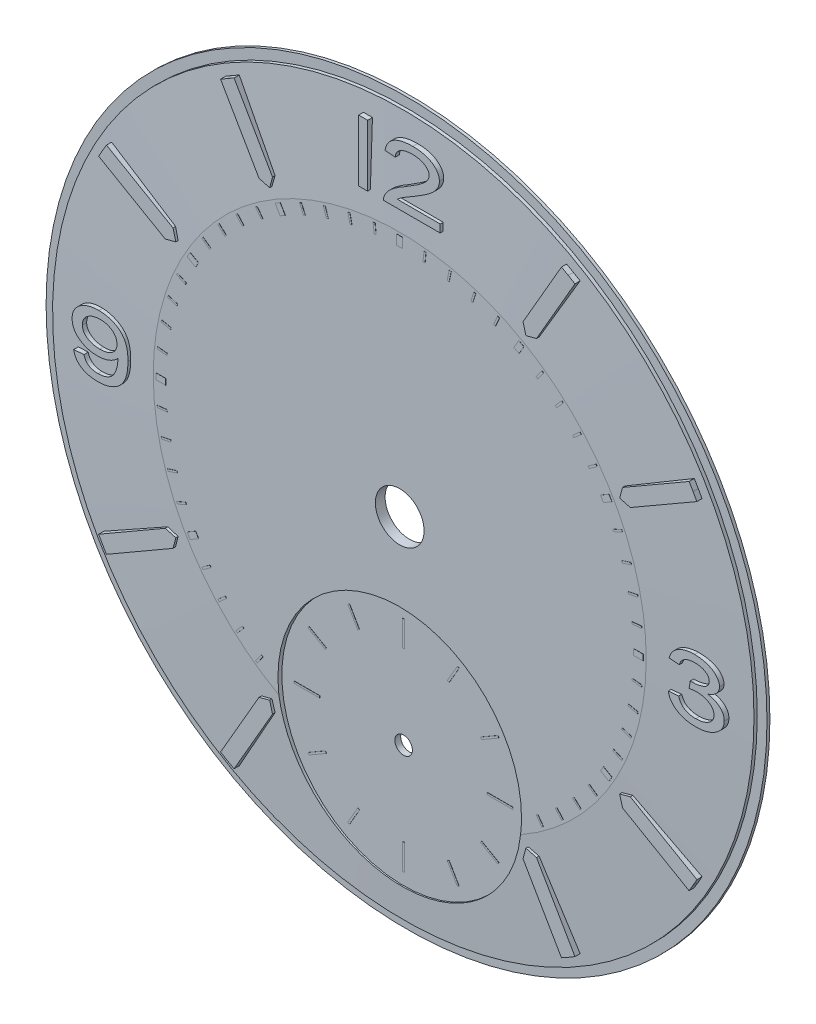
from build123d import *

# Parameters (mm, degrees)
SKETCH1_R           = 18.5
BOSS_EXTRUDE1_DEPTH = 0.5
CUT_EXTRUDE1_REACH  = 28.168
SKETCH2_R           = 1.25
SKETCH2_R_2         = 0.45
SKETCH11_R          = 1.25
BOSS_EXTRUDE7_DEPTH = 0.7
SKETCH12_R          = 0.55
BOSS_EXTRUDE8_DEPTH = 1.5
CHAMFER1_SIZE       = 0.7
CUT_EXTRUDE2_START  = 0.5
SKETCH4_R           = 6.25
CUT_EXTRUDE2_DEPTH  = 0.2
BOSS_EXTRUDE2_REACH = 28.855
BOSS_EXTRUDE2_START = 0.6
BOSS_EXTRUDE3_REACH = 28.855
BOSS_EXTRUDE3_START = 0.6
SKETCH6_W           = 0.46
SKETCH6_H           = 3.15
BOSS_EXTRUDE4_DEPTH = 0.01
SKETCH9_W           = 0.3
SKETCH9_H           = 0.500037505
SKETCH9_W_2         = 0.500037505
SKETCH9_H_2         = 0.3
BOSS_EXTRUDE5_DEPTH = 0.01
BOSS_EXTRUDE6_DEPTH = 0.01


with BuildPart() as part:
    # Sketch1 → Boss-Extrude1 (new body)
    with BuildSketch(Plane.XY):
        Circle(SKETCH1_R)
    extrude(amount=BOSS_EXTRUDE1_DEPTH)

    # Sketch2 → Cut-Extrude1 (cut, up to next)
    with BuildSketch(Plane.XY, mode=Mode.PRIVATE) as cut_extrude1_sk1:
        Circle(SKETCH2_R)
    cut_extrude1_tool1 = extrude(cut_extrude1_sk1.sketch, amount=CUT_EXTRUDE1_REACH, mode=Mode.PRIVATE) & part.part
    # Sketch2 → Cut-Extrude1 (cut, up to next)
    with BuildSketch(Plane.XY, mode=Mode.PRIVATE) as cut_extrude1_sk2:
        with Locations((0, -10.25)):
            Circle(SKETCH2_R_2)
    cut_extrude1_tool2 = extrude(cut_extrude1_sk2.sketch, amount=CUT_EXTRUDE1_REACH, mode=Mode.PRIVATE) & part.part
    add(cut_extrude1_tool1.solids().sort_by_distance((0, 0, 0))[0], mode=Mode.SUBTRACT)
    add(cut_extrude1_tool2.solids().sort_by_distance((0, -10.25, 0))[0], mode=Mode.SUBTRACT)

    # Sketch11 → Boss-Extrude7 (add)
    with BuildSketch(Plane(origin=(0, 0, 0), x_dir=(-1, 0, 0), z_dir=(0, 0, -1))):
        with Locations(Location((12.281, 9.674, 0), (0, 0, 180))):
            Circle(SKETCH11_R)
        with Locations(Location((-10.269, -11.676, 0), (0, 0, 180))):
            Circle(SKETCH11_R)
    extrude(amount=BOSS_EXTRUDE7_DEPTH)

    # Sketch12 → Boss-Extrude8 (add)
    with BuildSketch(Plane(origin=(0, 0, -0.7), x_dir=(-1, 0, 0), z_dir=(0, 0, -1))):
        with Locations((12.281, 9.674)):
            Circle(SKETCH12_R)
        with Locations((-10.269, -11.676)):
            Circle(SKETCH12_R)
    extrude(amount=BOSS_EXTRUDE8_DEPTH)

    # Chamfer1
    chamfer1_edges = [part.edges().sort_by_distance(p)[0] for p in [
        (-13.531, 9.674, -0.7),
        (9.019, -11.676, -0.7),
    ]]
    chamfer(chamfer1_edges, length=CHAMFER1_SIZE - 0.0001)  # a hair under: the kernel refuses the full size

    # Sketch3 → Cut-Revolve1 (revolve, cut)
    with BuildSketch(Plane(origin=(0, 0, 0), x_dir=(1, 0, 0), z_dir=(0, 1, 0))):
        Polygon((12.65, -0.5), (18, -0.317094017), (18, -0.15), (18.92774664, -0.15), (18.92659694, -0.3), (18.92659694, -0.873301672), (12.65, -0.873301672), align=None)
    revolve(axis=Axis((0, 0, 1000), (0, 0, -1)), mode=Mode.SUBTRACT)

    # Sketch4 → Cut-Extrude2 (cut)
    with BuildSketch(Plane.XY.offset(CUT_EXTRUDE2_START)):
        with Locations((0, -10.25)):
            Circle(SKETCH4_R)
    extrude(amount=-CUT_EXTRUDE2_DEPTH, mode=Mode.SUBTRACT)

    # Boss-Extrude2: up to this cone (the profile starts outside it)
    boss_extrude2_end = Plane(origin=(0, 0, 0.6), z_dir=(0, 0, -1)).offset(-0.332477632) * Cone(2.925e-05, 1152.815000001, 39.412477632, align=(Align.CENTER, Align.CENTER, Align.MIN), mode=Mode.PRIVATE)
    # Sketch5 → Boss-Extrude2 (add, up to the surface)
    with BuildSketch(Plane.XY.offset(BOSS_EXTRUDE2_START), mode=Mode.PRIVATE) as boss_extrude2_sk1:
        Polygon((6.575, 11.38823406), (7.121410162, 11.534644221), (9.094124149, 14.951485076), (8.75, 15.155444566), (8.401303826, 15.351485076), (6.428589838, 11.934644221), align=None)
    boss_extrude2_tool1 = extrude(boss_extrude2_sk1.sketch, amount=-BOSS_EXTRUDE2_REACH, mode=Mode.PRIVATE) - boss_extrude2_end
    add(boss_extrude2_tool1.solids().sort_by_distance((7.711125, 13.35606, 0.6))[0])
    # Sketch5 → Boss-Extrude2 (add, up to the surface)
    with BuildSketch(Plane.XY.offset(BOSS_EXTRUDE2_START), mode=Mode.PRIVATE) as boss_extrude2_sk2:
        Polygon((15.351485076, 8.401303826), (15.155444566, 8.75), (14.951485076, 9.094124149), (11.534644221, 7.121410162), (11.38823406, 6.575), (11.934644221, 6.428589838), align=None)
    boss_extrude2_tool2 = extrude(boss_extrude2_sk2.sketch, amount=-BOSS_EXTRUDE2_REACH, mode=Mode.PRIVATE) - boss_extrude2_end
    add(boss_extrude2_tool2.solids().sort_by_distance((13.35606, 7.711125, 0.6))[0])
    # Sketch5 → Boss-Extrude2 (add, up to the surface)
    with BuildSketch(Plane.XY.offset(BOSS_EXTRUDE2_START), mode=Mode.PRIVATE) as boss_extrude2_sk3:
        Polygon((14.951485076, -9.094124149), (15.155444566, -8.75), (15.351485076, -8.401303826), (11.934644221, -6.428589838), (11.38823406, -6.575), (11.534644221, -7.121410162), align=None)
    boss_extrude2_tool3 = extrude(boss_extrude2_sk3.sketch, amount=-BOSS_EXTRUDE2_REACH, mode=Mode.PRIVATE) - boss_extrude2_end
    add(boss_extrude2_tool3.solids().sort_by_distance((13.35606, -7.711125, 0.6))[0])
    # Sketch5 → Boss-Extrude2 (add, up to the surface)
    with BuildSketch(Plane.XY.offset(BOSS_EXTRUDE2_START), mode=Mode.PRIVATE) as boss_extrude2_sk4:
        Polygon((8.401303826, -15.351485076), (8.75, -15.155444566), (9.094124149, -14.951485076), (7.121410162, -11.534644221), (6.575, -11.38823406), (6.428589838, -11.934644221), align=None)
    boss_extrude2_tool4 = extrude(boss_extrude2_sk4.sketch, amount=-BOSS_EXTRUDE2_REACH, mode=Mode.PRIVATE) - boss_extrude2_end
    add(boss_extrude2_tool4.solids().sort_by_distance((7.711125, -13.35606, 0.6))[0])
    # Sketch5 → Boss-Extrude2 (add, up to the surface)
    with BuildSketch(Plane.XY.offset(BOSS_EXTRUDE2_START), mode=Mode.PRIVATE) as boss_extrude2_sk5:
        Polygon((-9.094124149, -14.951485076), (-8.75, -15.155444566), (-8.401303826, -15.351485076), (-6.428589838, -11.934644221), (-6.575, -11.38823406), (-7.121410162, -11.534644221), align=None)
    boss_extrude2_tool5 = extrude(boss_extrude2_sk5.sketch, amount=-BOSS_EXTRUDE2_REACH, mode=Mode.PRIVATE) - boss_extrude2_end
    add(boss_extrude2_tool5.solids().sort_by_distance((-7.711125, -13.35606, 0.6))[0])
    # Sketch5 → Boss-Extrude2 (add, up to the surface)
    with BuildSketch(Plane.XY.offset(BOSS_EXTRUDE2_START), mode=Mode.PRIVATE) as boss_extrude2_sk6:
        Polygon((-15.351485076, -8.401303826), (-15.155444566, -8.75), (-14.951485076, -9.094124149), (-11.534644221, -7.121410162), (-11.38823406, -6.575), (-11.934644221, -6.428589838), align=None)
    boss_extrude2_tool6 = extrude(boss_extrude2_sk6.sketch, amount=-BOSS_EXTRUDE2_REACH, mode=Mode.PRIVATE) - boss_extrude2_end
    add(boss_extrude2_tool6.solids().sort_by_distance((-13.35606, -7.711125, 0.6))[0])
    # Sketch5 → Boss-Extrude2 (add, up to the surface)
    with BuildSketch(Plane.XY.offset(BOSS_EXTRUDE2_START), mode=Mode.PRIVATE) as boss_extrude2_sk7:
        Polygon((-14.951485076, 9.094124149), (-15.155444566, 8.75), (-15.351485076, 8.401303826), (-11.934644221, 6.428589838), (-11.38823406, 6.575), (-11.534644221, 7.121410162), align=None)
    boss_extrude2_tool7 = extrude(boss_extrude2_sk7.sketch, amount=-BOSS_EXTRUDE2_REACH, mode=Mode.PRIVATE) - boss_extrude2_end
    add(boss_extrude2_tool7.solids().sort_by_distance((-13.35606, 7.711125, 0.6))[0])
    # Sketch5 → Boss-Extrude2 (add, up to the surface)
    with BuildSketch(Plane.XY.offset(BOSS_EXTRUDE2_START), mode=Mode.PRIVATE) as boss_extrude2_sk8:
        Polygon((-8.401303826, 15.351485076), (-8.75, 15.155444566), (-9.094124149, 14.951485076), (-7.121410162, 11.534644221), (-6.575, 11.38823406), (-6.428589838, 11.934644221), align=None)
    boss_extrude2_tool8 = extrude(boss_extrude2_sk8.sketch, amount=-BOSS_EXTRUDE2_REACH, mode=Mode.PRIVATE) - boss_extrude2_end
    add(boss_extrude2_tool8.solids().sort_by_distance((-7.711125, 13.35606, 0.6))[0])

    # Boss-Extrude3: up to this cone (the profile starts outside it)
    boss_extrude3_end = Plane(origin=(0, 0, 0.6), z_dir=(0, 0, -1)).offset(-0.332477632) * Cone(2.925e-05, 1152.815000001, 39.412477632, align=(Align.CENTER, Align.CENTER, Align.MIN), mode=Mode.PRIVATE)
    # Sketch6 → Boss-Extrude3 (add, up to the surface)
    with BuildSketch(Plane.XY.offset(BOSS_EXTRUDE3_START), mode=Mode.PRIVATE) as boss_extrude3_sk1:
        with Locations((-1.776843897, 15.325)):
            Rectangle(SKETCH6_W, SKETCH6_H)
    boss_extrude3_tool1 = extrude(boss_extrude3_sk1.sketch, amount=-BOSS_EXTRUDE3_REACH, mode=Mode.PRIVATE) - boss_extrude3_end
    add(boss_extrude3_tool1.solids().sort_by_distance((-1.776844, 15.325, 0.6))[0])
    # Sketch6 → Boss-Extrude3 (add, up to the surface)
    with BuildSketch(Plane.XY.offset(BOSS_EXTRUDE3_START), mode=Mode.PRIVATE) as boss_extrude3_sk2:
        with BuildLine():
            Line((2.176923077, 14.153846154), (2.176923077, 13.75))
            Line((2.176923077, 13.75), (-0.730769231, 13.75))
            add(Edge.make_bspline(
                [(-0.730769231, 13.75), (-0.730734683, 13.773801761), (-0.730665513, 13.821456454), (-0.719779166, 13.892481272), (-0.698725172, 13.962001872), (-0.678109362, 14.005994642), (-0.667668269, 14.02827524)],
                knots=[0, 0, 0, 0, 0.989243062, 1.980612825, 2.977260274, 4, 4, 4, 4], degree=3))
            add(Edge.make_bspline(
                [(-0.667668269, 14.02827524), (-0.647284543, 14.065209714), (-0.605166279, 14.141526279), (-0.522772684, 14.249013191), (-0.424981238, 14.355602486), (-0.330460341, 14.441240537), (-0.24617537, 14.510878124), (-0.174790035, 14.564857758), (-0.096887456, 14.620542359), (-0.012584844, 14.677547534), (0.077965903, 14.736772872), (0.175675543, 14.79625478), (0.279915656, 14.85748709), (0.35178063, 14.898317805), (0.388641827, 14.919260817)],
                knots=[0, 0, 0, 0, 1.082780595, 2.23731618, 3.469163426, 4.796636591, 5.510850007, 6.278397041, 7.095858807, 7.971372559, 8.893386428, 9.876020042, 10.91056187, 12, 12, 12, 12], degree=3))
            add(Edge.make_bspline(
                [(0.388641827, 14.919260817), (0.445292328, 14.953431166), (0.554273617, 15.019166308), (0.710001949, 15.115602301), (0.852062308, 15.205848747), (0.979384685, 15.290962136), (1.093809159, 15.368703826), (1.192716293, 15.442368609), (1.278642324, 15.508653387), (1.351686129, 15.570136196), (1.413201925, 15.628957661), (1.465967037, 15.686317715), (1.51027665, 15.743433172), (1.547691208, 15.799414011), (1.575477347, 15.856078609), (1.595823996, 15.911873622), (1.609576145, 15.967125098), (1.610892005, 16.00410039), (1.611538462, 16.022265625)],
                knots=[0, 0, 0, 0, 1.868118289, 3.593788876, 5.172198056, 6.620162334, 7.918373262, 9.077768068, 10.101891799, 10.982542333, 11.772277537, 12.50380925, 13.1810016, 13.811946086, 14.401621127, 14.957769458, 15.487972581, 16, 16, 16, 16], degree=3))
            add(Edge.make_bspline(
                [(1.611538462, 16.022265625), (1.610745361, 16.039975811), (1.609172808, 16.075091397), (1.598554309, 16.12684664), (1.578759707, 16.175625374), (1.553624366, 16.223263528), (1.519659301, 16.267829013), (1.478772576, 16.310536787), (1.430359275, 16.35088742), (1.375312931, 16.389009764), (1.314210633, 16.423503409), (1.248324575, 16.453756531), (1.177987432, 16.479941252), (1.102887351, 16.500221592), (1.023530127, 16.517038386), (0.939750252, 16.527858491), (0.85150834, 16.535082743), (0.79124142, 16.536044694), (0.76030649, 16.536538462)],
                knots=[0, 0, 0, 0, 0.775419244, 1.537493863, 2.298399441, 3.072943494, 3.888749766, 4.741893806, 5.656754112, 6.642668583, 7.669401872, 8.724078032, 9.81362824, 10.950698062, 12.126297407, 13.362088999, 14.645963818, 16, 16, 16, 16], degree=3))
            add(Edge.make_bspline(
                [(0.76030649, 16.536538462), (0.727690907, 16.536036152), (0.664066967, 16.535056286), (0.571184002, 16.527958378), (0.483252531, 16.5169206), (0.400338045, 16.500629217), (0.322417377, 16.478962758), (0.249307164, 16.453401791), (0.181173505, 16.423080002), (0.118955962, 16.387831289), (0.062513177, 16.34883766), (0.012862769, 16.305957733), (-0.029000272, 16.258995672), (-0.063729246, 16.208701882), (-0.090314401, 16.15436298), (-0.11005695, 16.096548737), (-0.12228759, 16.034968357), (-0.124085739, 15.992663547), (-0.125, 15.971153846)],
                knots=[0, 0, 0, 0, 1.336175627, 2.606507352, 3.81435817, 4.965286254, 6.065003821, 7.125251149, 8.13586676, 9.116042774, 10.050766458, 10.942513058, 11.797005481, 12.621644516, 13.438683862, 14.267141418, 15.118935392, 16, 16, 16, 16], degree=3))
            Line((-0.125, 15.971153846), (-0.65, 16.011538462))
            add(Edge.make_bspline(
                [(-0.65, 16.011538462), (-0.644513326, 16.046840535), (-0.633767387, 16.115981504), (-0.60391714, 16.215056292), (-0.565588693, 16.30799834), (-0.516614644, 16.394465543), (-0.457444952, 16.474292551), (-0.389004304, 16.547895433), (-0.31055033, 16.614635221), (-0.22243017, 16.674271965), (-0.125890198, 16.728090207), (-0.020638293, 16.773824815), (0.092211307, 16.813037774), (0.212837854, 16.845147187), (0.341525504, 16.869511867), (0.477860044, 16.886919107), (0.62214857, 16.897841735), (0.720953571, 16.899267985), (0.771664663, 16.9)],
                knots=[0, 0, 0, 0, 0.926926747, 1.815434827, 2.679851767, 3.533638517, 4.389171254, 5.25501982, 6.138508896, 7.058276303, 8.014443804, 9.005118448, 10.034834552, 11.114826492, 12.244098521, 13.433982082, 14.683006236, 16, 16, 16, 16], degree=3))
            add(Edge.make_bspline(
                [(0.771664663, 16.9), (0.822802795, 16.899374971), (0.922493349, 16.898156515), (1.068068255, 16.885734958), (1.205509175, 16.866558139), (1.334905221, 16.839679085), (1.455759783, 16.804286174), (1.568525472, 16.761420534), (1.673339713, 16.711023555), (1.768850623, 16.652517272), (1.854529354, 16.588162053), (1.930292214, 16.520381095), (1.99367253, 16.447891852), (2.046635412, 16.372426178), (2.08633817, 16.291955115), (2.115813339, 16.208403355), (2.133399049, 16.120593018), (2.135480637, 16.060836108), (2.136538462, 16.03046875)],
                knots=[0, 0, 0, 0, 1.366966317, 2.664814376, 3.903105881, 5.075541585, 6.194876334, 7.266445866, 8.297663522, 9.299764706, 10.255787209, 11.159518581, 12.012314952, 12.825026505, 13.617244577, 14.403351232, 15.18861259, 16, 16, 16, 16], degree=3))
            add(Edge.make_bspline(
                [(2.136538462, 16.03046875), (2.135367745, 15.999235514), (2.13301135, 15.936369891), (2.112227791, 15.842849812), (2.079735013, 15.750148333), (2.034484867, 15.657339251), (1.972760507, 15.564664209), (1.895408917, 15.470230503), (1.800832437, 15.373454859), (1.709780637, 15.291581318), (1.62474685, 15.223436745), (1.549692108, 15.166443356), (1.463377826, 15.106393105), (1.367805686, 15.04034697), (1.260604143, 14.971329748), (1.143736536, 14.89681964), (1.016028937, 14.818731488), (0.927357759, 14.76564128), (0.881460337, 14.738161058)],
                knots=[0, 0, 0, 0, 0.797472085, 1.605135574, 2.436550896, 3.304515204, 4.236452966, 5.275912425, 6.420307762, 7.691835688, 8.402981861, 9.205097542, 10.1000472, 11.090178053, 12.174238999, 13.358439029, 14.63269166, 16, 16, 16, 16], degree=3))
            add(Edge.make_bspline(
                [(0.881460337, 14.738161058), (0.842760848, 14.715651026), (0.768699194, 14.672572159), (0.662482019, 14.610875296), (0.567002026, 14.55412499), (0.481455859, 14.503331852), (0.406034433, 14.459085302), (0.341130878, 14.419590097), (0.286800924, 14.385701232), (0.228220219, 14.349387049), (0.165982033, 14.306575278), (0.09709343, 14.257221997), (0.036137644, 14.206160463), (-0.001067873, 14.170853905), (-0.018990385, 14.153846154)],
                knots=[0, 0, 0, 0, 1.498073862, 2.866958499, 4.11022804, 5.214683684, 6.196023589, 7.036135443, 7.756818607, 8.338735797, 9.342114208, 10.283889564, 11.173321292, 12, 12, 12, 12], degree=3))
            Line((-0.018990385, 14.153846154), (2.176923077, 14.153846154))
        make_face()
    boss_extrude3_tool2 = extrude(boss_extrude3_sk2.sketch, amount=-BOSS_EXTRUDE3_REACH, mode=Mode.PRIVATE) - boss_extrude3_end
    add(boss_extrude3_tool2.solids().sort_by_distance((2.134054, 13.951923, 0.6))[0])
    # Sketch6 → Boss-Extrude3 (add, up to the surface)
    with BuildSketch(Plane.XY.offset(BOSS_EXTRUDE3_START), mode=Mode.PRIVATE) as boss_extrude3_sk3:
        with BuildLine():
            Line((13.886538462, -0.751923077), (14.411538462, -0.711538462))
            add(Edge.make_bspline(
                [(14.411538462, -0.711538462), (14.419782578, -0.735870822), (14.435856374, -0.783312339), (14.465926226, -0.850814196), (14.499639345, -0.91288714), (14.537328528, -0.969988996), (14.57880749, -1.021464193), (14.623962575, -1.068258628), (14.673431727, -1.109245838), (14.726636748, -1.145475248), (14.78416013, -1.176413729), (14.845283973, -1.203559922), (14.910695185, -1.226393443), (14.980216427, -1.244383709), (15.053545551, -1.258869341), (15.13083423, -1.269665404), (15.212391232, -1.276032449), (15.268227668, -1.276621286), (15.296844952, -1.276923077)],
                knots=[0, 0, 0, 0, 1.081617508, 2.108861367, 3.107907368, 4.053891101, 4.98642157, 5.888579411, 6.788079934, 7.687405932, 8.595244187, 9.535235353, 10.501859968, 11.509666268, 12.557335972, 13.648597587, 14.794859463, 16, 16, 16, 16], degree=3))
            add(Edge.make_bspline(
                [(15.296844952, -1.276923077), (15.330314071, -1.276588049), (15.395904092, -1.275931489), (15.491921925, -1.266387647), (15.583604064, -1.253280267), (15.670137422, -1.232685385), (15.752102824, -1.207608318), (15.829242745, -1.176762838), (15.9016319, -1.139932069), (15.9687876, -1.097919469), (16.029636814, -1.051879059), (16.082474817, -1.002155265), (16.127722043, -0.950430747), (16.16488246, -0.895682633), (16.19353825, -0.837909322), (16.213579665, -0.777338684), (16.22713136, -0.714241049), (16.228268693, -0.671015512), (16.228846154, -0.64906851)],
                knots=[0, 0, 0, 0, 1.28866494, 2.525419338, 3.713690651, 4.853576377, 5.94785981, 7.013081976, 8.049409785, 9.072284432, 10.060791826, 10.983630342, 11.862453451, 12.702902981, 13.525430756, 14.337638125, 15.155965118, 16, 16, 16, 16], degree=3))
            add(Edge.make_bspline(
                [(16.228846154, -0.64906851), (16.22821178, -0.628180198), (16.226964017, -0.587094504), (16.214268224, -0.527083741), (16.194805769, -0.469949053), (16.167269267, -0.415520292), (16.131421771, -0.364297328), (16.088333361, -0.315504111), (16.037159119, -0.2697711), (15.978759981, -0.227552798), (15.914882008, -0.188378866), (15.845599575, -0.155045271), (15.772169695, -0.126578087), (15.694482639, -0.103376379), (15.612673798, -0.085064727), (15.526689724, -0.071772415), (15.436223215, -0.064274341), (15.374472828, -0.06333879), (15.342908654, -0.062860577)],
                knots=[0, 0, 0, 0, 0.850254533, 1.672384945, 2.488414119, 3.30502847, 4.149210918, 5.029865481, 5.952536532, 6.940184485, 7.963464691, 9.002495723, 10.069133905, 11.170250404, 12.303728621, 13.48343305, 14.713637887, 16, 16, 16, 16], degree=3))
            add(Edge.make_bspline(
                [(15.342908654, -0.062860577), (15.315125367, -0.063349896), (15.256295099, -0.064386013), (15.163291861, -0.073549153), (15.060502643, -0.086425984), (14.989071975, -0.099123114), (14.951682692, -0.105769231)],
                knots=[0, 0, 0, 0, 0.845875475, 1.791115689, 2.84379354, 4, 4, 4, 4], degree=3))
            Line((14.951682692, -0.105769231), (15.012890625, 0.257692308))
            add(Edge.make_bspline(
                [(15.012890625, 0.257692308), (15.029500349, 0.256497747), (15.058916571, 0.254382152), (15.088397363, 0.253610976), (15.101231971, 0.25327524)],
                knots=[0, 0, 0, 0, 1.129290121, 2, 2, 2, 2], degree=3))
            add(Edge.make_bspline(
                [(15.101231971, 0.25327524), (15.156628034, 0.254699639), (15.26493186, 0.257484455), (15.423061505, 0.280147258), (15.572908555, 0.316546876), (15.69053259, 0.359155043), (15.776947387, 0.40073546), (15.832471719, 0.436809243), (15.880513476, 0.476148268), (15.919008035, 0.520491434), (15.949494965, 0.568717437), (15.971098547, 0.620957892), (15.98398938, 0.677325561), (15.985676526, 0.716158488), (15.986538462, 0.735997596)],
                knots=[0, 0, 0, 0, 1.790914263, 3.501383629, 5.154540887, 6.770799901, 7.537430951, 8.250654314, 8.907366996, 9.538973029, 10.141060002, 10.744912067, 11.358796088, 12, 12, 12, 12], degree=3))
            add(Edge.make_bspline(
                [(15.986538462, 0.735997596), (15.985968441, 0.752036571), (15.984847995, 0.78356313), (15.974858538, 0.829621963), (15.959343565, 0.873690406), (15.935835316, 0.914791482), (15.907364692, 0.954641832), (15.871489714, 0.99144945), (15.830389254, 1.027432872), (15.782303366, 1.059290226), (15.730343658, 1.090095113), (15.67332688, 1.115366693), (15.613214077, 1.13788575), (15.549127167, 1.15525078), (15.48147741, 1.169169717), (15.41002406, 1.179068122), (15.334830521, 1.185693775), (15.283398304, 1.18625262), (15.257091346, 1.186538462)],
                knots=[0, 0, 0, 0, 0.811395687, 1.594897043, 2.376730834, 3.168302309, 3.984439778, 4.851026099, 5.765033413, 6.74605641, 7.767489427, 8.821082463, 9.899639694, 11.016197707, 12.179938029, 13.395760394, 14.667962916, 16, 16, 16, 16], degree=3))
            add(Edge.make_bspline(
                [(15.257091346, 1.186538462), (15.230998681, 1.186194409), (15.180011067, 1.185522096), (15.105228062, 1.179700372), (15.033795257, 1.170342427), (14.965496849, 1.157133779), (14.900353622, 1.140101543), (14.838482768, 1.119447824), (14.780112005, 1.094629128), (14.725244626, 1.066531866), (14.674512026, 1.034247687), (14.628213857, 0.998138951), (14.586346104, 0.958385156), (14.549480342, 0.914594433), (14.517863515, 0.866793347), (14.490539116, 0.815563449), (14.468333315, 0.760271336), (14.457456728, 0.721598531), (14.451923077, 0.701923077)],
                knots=[0, 0, 0, 0, 1.228256832, 2.400133735, 3.528920398, 4.618409361, 5.672817293, 6.696794339, 7.686291318, 8.656221101, 9.59569738, 10.512832785, 11.416341944, 12.308932161, 13.201522379, 14.109632333, 15.038243001, 16, 16, 16, 16], degree=3))
            Line((14.451923077, 0.701923077), (13.926923077, 0.742307692))
            add(Edge.make_bspline(
                [(13.926923077, 0.742307692), (13.935807762, 0.773627741), (13.953374319, 0.835552888), (13.989585025, 0.924236193), (14.033920857, 1.007252819), (14.086135786, 1.084667008), (14.145508944, 1.157164654), (14.213710964, 1.223381221), (14.288970795, 1.285105577), (14.37247574, 1.340093837), (14.461775113, 1.389954618), (14.556944694, 1.433076823), (14.657556369, 1.468795397), (14.763191636, 1.498411536), (14.874011171, 1.521991496), (14.990230238, 1.537872613), (15.111761665, 1.548484882), (15.194597725, 1.549487831), (15.236899038, 1.55)],
                knots=[0, 0, 0, 0, 0.937790759, 1.854174284, 2.754617377, 3.64576768, 4.541525143, 5.450357671, 6.38108714, 7.342850054, 8.327964663, 9.326401376, 10.350388651, 11.402138583, 12.486509707, 13.61307026, 14.781083209, 16, 16, 16, 16], degree=3))
            add(Edge.make_bspline(
                [(15.236899038, 1.55), (15.295218638, 1.548650273), (15.409901267, 1.5459961), (15.578247608, 1.525567764), (15.739306928, 1.491399065), (15.867896216, 1.451955979), (15.965340024, 1.414082364), (16.034240554, 1.383826361), (16.098137391, 1.350438497), (16.158211455, 1.314979488), (16.213350781, 1.276667287), (16.264519747, 1.235932558), (16.310945689, 1.192691736), (16.352811632, 1.147016942), (16.389697726, 1.100014874), (16.422277715, 1.052233908), (16.450323043, 1.003975827), (16.472146107, 0.954231525), (16.490562162, 0.904303952), (16.501886314, 0.853102527), (16.510195788, 0.80147047), (16.511088717, 0.766741085), (16.511538462, 0.749248798)],
                knots=[0, 0, 0, 0, 2.110718556, 4.150624387, 6.127782552, 8.064085263, 9.011429675, 9.911290832, 10.786494461, 11.619584125, 12.434842787, 13.214888947, 13.985250755, 14.728924724, 15.455485946, 16.146048055, 16.821287425, 17.472222049, 18.110384955, 18.743852238, 19.367311073, 20, 20, 20, 20], degree=3))
            add(Edge.make_bspline(
                [(16.511538462, 0.749248798), (16.510998198, 0.732820569), (16.509919889, 0.700031577), (16.502922362, 0.651361631), (16.490933956, 0.603744174), (16.473598219, 0.557618398), (16.452224808, 0.512411624), (16.425193406, 0.468870111), (16.394419785, 0.425701633), (16.358329184, 0.384286247), (16.31780737, 0.344179809), (16.272211534, 0.306776419), (16.222926814, 0.270277881), (16.168226528, 0.236972512), (16.109044922, 0.205776578), (16.045700204, 0.175696631), (15.977448543, 0.148814245), (15.930028442, 0.132761536), (15.905769231, 0.124549279)],
                knots=[0, 0, 0, 0, 0.845647761, 1.687822622, 2.525531161, 3.368262647, 4.220607483, 5.095218299, 6.002720632, 6.946942806, 7.919302105, 8.934079419, 9.980087931, 11.073870733, 12.226672158, 13.423039731, 14.681676672, 16, 16, 16, 16], degree=3))
            add(Edge.make_bspline(
                [(15.905769231, 0.124549279), (15.937612401, 0.118845483), (15.999793718, 0.107707472), (16.089930505, 0.084646579), (16.174822585, 0.057654187), (16.255204299, 0.026851744), (16.329973827, -0.009391711), (16.40065973, -0.048633327), (16.464956762, -0.094202463), (16.525081623, -0.142179017), (16.578708742, -0.194636373), (16.625834487, -0.250145645), (16.665164043, -0.309359857), (16.697713736, -0.371683975), (16.722988169, -0.437298543), (16.740650606, -0.506345231), (16.751592029, -0.578256535), (16.753088598, -0.627365073), (16.753846154, -0.652223558)],
                knots=[0, 0, 0, 0, 1.232720324, 2.407177833, 3.543076029, 4.626940314, 5.684784821, 6.70803774, 7.70439802, 8.684793134, 9.637254802, 10.55905793, 11.455156574, 12.340866153, 13.234198998, 14.128682304, 15.052748811, 16, 16, 16, 16], degree=3))
            add(Edge.make_bspline(
                [(16.753846154, -0.652223558), (16.752724892, -0.686187044), (16.750511708, -0.753225272), (16.730073849, -0.851559462), (16.697115023, -0.945857404), (16.650328698, -1.035988112), (16.591065215, -1.122475386), (16.518571306, -1.204821953), (16.432515464, -1.282351106), (16.335194559, -1.355627759), (16.228168423, -1.422783155), (16.112658251, -1.480841884), (15.990440934, -1.530150186), (15.861272646, -1.570511311), (15.725396791, -1.601868378), (15.58270334, -1.624689736), (15.432975655, -1.637925405), (15.330735465, -1.639553522), (15.278545673, -1.640384615)],
                knots=[0, 0, 0, 0, 0.829445895, 1.637187125, 2.443798291, 3.264785789, 4.111956619, 5.001019776, 5.940094244, 6.93866161, 7.975879301, 9.024479869, 10.094853617, 11.194216784, 12.329232813, 13.500881998, 14.724293751, 16, 16, 16, 16], degree=3))
            add(Edge.make_bspline(
                [(15.278545673, -1.640384615), (15.231398789, -1.639771057), (15.139048825, -1.638569237), (15.003848174, -1.625832419), (14.874686448, -1.607647627), (14.751848106, -1.580145177), (14.634598882, -1.545749933), (14.523771421, -1.502722631), (14.418642028, -1.452792311), (14.320784466, -1.394966705), (14.2308873, -1.331188476), (14.150795403, -1.262088401), (14.080885882, -1.188640848), (14.020904651, -1.110561291), (13.971441841, -1.02747633), (13.932227101, -0.939807635), (13.902323321, -0.847843777), (13.891829946, -0.784078125), (13.886538462, -0.751923077)],
                knots=[0, 0, 0, 0, 1.254873472, 2.458010146, 3.612718685, 4.725506212, 5.806341006, 6.862966724, 7.887433979, 8.90165615, 9.885315847, 10.81831756, 11.713564031, 12.580495754, 13.434305196, 14.281532807, 15.133430102, 16, 16, 16, 16], degree=3))
        make_face()
    boss_extrude3_tool3 = extrude(boss_extrude3_sk3.sketch, amount=-BOSS_EXTRUDE3_REACH, mode=Mode.PRIVATE) - boss_extrude3_end
    add(boss_extrude3_tool3.solids().sort_by_distance((15.494489, -0.067641, 0.6))[0])
    # Sketch6 → Boss-Extrude3 (add, up to the surface)
    with BuildSketch(Plane.XY.offset(BOSS_EXTRUDE3_START), mode=Mode.PRIVATE) as boss_extrude3_sk4:
        with BuildLine():
            Line((-16.632692308, -0.832692308), (-16.107692308, -0.792307692))
            add(Edge.make_bspline(
                [(-16.107692308, -0.792307692), (-16.101985592, -0.813052038), (-16.090886796, -0.853397011), (-16.068045221, -0.910438012), (-16.043592139, -0.96388968), (-16.013129542, -1.01184149), (-15.980660817, -1.056700866), (-15.943097814, -1.096206072), (-15.902569534, -1.132034215), (-15.857930347, -1.163032171), (-15.810021877, -1.189912231), (-15.759071464, -1.21363088), (-15.704738705, -1.233039434), (-15.647071437, -1.248678788), (-15.586170878, -1.261265326), (-15.522173548, -1.270925222), (-15.454670311, -1.27568867), (-15.408749947, -1.276504461), (-15.385186298, -1.276923077)],
                knots=[0, 0, 0, 0, 1.085859112, 2.111850413, 3.100353163, 4.049769539, 4.976258634, 5.893317882, 6.796860135, 7.704702472, 8.63247003, 9.568957172, 10.540237201, 11.542913164, 12.584790247, 13.680171897, 14.809599714, 16, 16, 16, 16], degree=3))
            add(Edge.make_bspline(
                [(-15.385186298, -1.276923077), (-15.345175684, -1.275950063), (-15.266777213, -1.2740435), (-15.152517668, -1.25925008), (-15.044342174, -1.235659751), (-14.943692237, -1.20138599), (-14.851153349, -1.159895636), (-14.769326335, -1.110233035), (-14.69738559, -1.055333714), (-14.635958358, -0.991635015), (-14.582440994, -0.918547711), (-14.533271861, -0.835375828), (-14.487892088, -0.740730588), (-14.44710677, -0.636100636), (-14.411815471, -0.52503924), (-14.386550759, -0.409966882), (-14.370906623, -0.293192323), (-14.368969146, -0.214561171), (-14.367998798, -0.175180288)],
                knots=[0, 0, 0, 0, 1.130195708, 2.214552793, 3.249818524, 4.253416384, 5.213522059, 6.109438218, 6.952295126, 7.763461977, 8.600262652, 9.50637114, 10.489865325, 11.562596652, 12.677262828, 13.778924705, 14.887617653, 16, 16, 16, 16], degree=3))
            add(Edge.make_bspline(
                [(-14.367998798, -0.175180288), (-14.368127022, -0.164450008), (-14.368434003, -0.138760681), (-14.370152914, -0.113124952), (-14.371153846, -0.098197115)],
                knots=[0, 0, 0, 0, 0.835388221, 2, 2, 2, 2], degree=3))
            add(Edge.make_bspline(
                [(-14.371153846, -0.098197115), (-14.399873678, -0.128019378), (-14.458603526, -0.18900361), (-14.563018457, -0.267484515), (-14.681271635, -0.337878749), (-14.812959962, -0.398166524), (-14.954422321, -0.447720613), (-15.103339922, -0.483951742), (-15.258118045, -0.505846295), (-15.36345067, -0.508349203), (-15.416736779, -0.509615385)],
                knots=[0, 0, 0, 0, 0.859015133, 1.756619853, 2.703129174, 3.713947706, 4.760115879, 5.81254412, 6.893400682, 8, 8, 8, 8], degree=3))
            add(Edge.make_bspline(
                [(-15.416736779, -0.509615385), (-15.461155824, -0.508818992), (-15.548514214, -0.507252736), (-15.676868026, -0.493356842), (-15.800466994, -0.472563277), (-15.918476023, -0.441263789), (-16.031558257, -0.402298652), (-16.138994652, -0.353930166), (-16.241909705, -0.298026238), (-16.337663031, -0.232438565), (-16.425934275, -0.160874935), (-16.502734049, -0.082263269), (-16.567829789, 0.0017433), (-16.62142598, 0.091197704), (-16.662580459, 0.186786983), (-16.692371596, 0.287776124), (-16.710468752, 0.394391033), (-16.71245266, 0.467326924), (-16.713461538, 0.504417067)],
                knots=[0, 0, 0, 0, 1.159900699, 2.281162421, 3.368682418, 4.430771739, 5.466354645, 6.489445, 7.504969033, 8.521384398, 9.51679408, 10.468676127, 11.385193055, 12.286918046, 13.185087644, 14.096021541, 15.031768418, 16, 16, 16, 16], degree=3))
            add(Edge.make_bspline(
                [(-16.713461538, 0.504417067), (-16.712262956, 0.542777515), (-16.709910907, 0.618054543), (-16.690989063, 0.727941973), (-16.661129222, 0.8322748), (-16.617280332, 0.930309266), (-16.562477234, 1.023190485), (-16.493737026, 1.109335392), (-16.414111344, 1.1905148), (-16.322331786, 1.264386702), (-16.221973454, 1.331444672), (-16.114545916, 1.390286364), (-16.000831695, 1.439628314), (-15.881135386, 1.480055857), (-15.755134223, 1.51151836), (-15.62291745, 1.534226083), (-15.484529945, 1.547527483), (-15.390263263, 1.549165952), (-15.342277644, 1.55)],
                knots=[0, 0, 0, 0, 0.955285046, 1.87461364, 2.77018139, 3.652462423, 4.543186529, 5.450106946, 6.391431098, 7.371201683, 8.3799789, 9.395540352, 10.418861493, 11.464643795, 12.54000218, 13.651483741, 14.804508608, 16, 16, 16, 16], degree=3))
            add(Edge.make_bspline(
                [(-15.342277644, 1.55), (-15.307140697, 1.549503685), (-15.237625453, 1.548521772), (-15.134563036, 1.54104578), (-15.034021679, 1.527295994), (-14.935445667, 1.510272086), (-14.839425131, 1.486269356), (-14.745181446, 1.459047359), (-14.653639556, 1.425343524), (-14.564864265, 1.386769245), (-14.479163778, 1.344619412), (-14.399127274, 1.296398976), (-14.3241382, 1.244279316), (-14.253747618, 1.188422982), (-14.189591726, 1.126987845), (-14.130445179, 1.061674729), (-14.076766673, 0.991980716), (-14.027498288, 0.917742727), (-13.984198944, 0.836722959), (-13.946945585, 0.747762821), (-13.915617541, 0.650183791), (-13.889740663, 0.544135424), (-13.870825923, 0.429526944), (-13.855960645, 0.306823657), (-13.848220735, 0.175549694), (-13.846856207, 0.085224781), (-13.846153846, 0.038731971)],
                knots=[0, 0, 0, 0, 1.040501564, 2.058537376, 3.057511158, 4.044725694, 5.019143764, 5.986849619, 6.948462321, 7.905383412, 8.85248298, 9.774360771, 10.669397215, 11.555590458, 12.432342616, 13.296727801, 14.162615311, 15.035042293, 15.932351588, 16.878652011, 17.887172993, 18.964316647, 20.10813849, 21.324980954, 22.623091379, 24, 24, 24, 24], degree=3))
            add(Edge.make_bspline(
                [(-13.846153846, 0.038731971), (-13.846481627, -0.00987382), (-13.847120747, -0.104647569), (-13.856619531, -0.242914866), (-13.869687837, -0.373827898), (-13.890336014, -0.496919011), (-13.914892824, -0.61286193), (-13.946704034, -0.72063065), (-13.983033084, -0.821316712), (-14.026205972, -0.914129762), (-14.074532469, -1.000805965), (-14.12829581, -1.081848704), (-14.187628461, -1.1575495), (-14.252380196, -1.228264782), (-14.323054361, -1.293080409), (-14.39919111, -1.352507641), (-14.480388662, -1.407260279), (-14.567255022, -1.456100991), (-14.658828166, -1.499555294), (-14.754206182, -1.537608023), (-14.853807336, -1.569174552), (-14.957200585, -1.59461442), (-15.064264009, -1.615946699), (-15.175157542, -1.630176425), (-15.28999081, -1.638326733), (-15.367715281, -1.639690535), (-15.407271635, -1.640384615)],
                knots=[0, 0, 0, 0, 1.333513143, 2.600143616, 3.801659726, 4.942238219, 6.023437419, 7.051762723, 8.023230001, 8.958084881, 9.857319466, 10.744187529, 11.62402186, 12.494127864, 13.372389386, 14.252223716, 15.142297778, 16.057251613, 16.984107492, 17.921951069, 18.872987467, 19.848714949, 20.842591785, 21.867087065, 22.914495544, 24, 24, 24, 24], degree=3))
            add(Edge.make_bspline(
                [(-15.407271635, -1.640384615), (-15.448941626, -1.639867139), (-15.530517071, -1.6388541), (-15.649753257, -1.628361419), (-15.763437871, -1.612307537), (-15.871130181, -1.588892984), (-15.973233979, -1.559616313), (-16.068987485, -1.522460142), (-16.159533023, -1.480043222), (-16.243322056, -1.429948062), (-16.320641296, -1.374747571), (-16.389668989, -1.313264533), (-16.450797022, -1.246469288), (-16.504079298, -1.174577201), (-16.54853668, -1.096653103), (-16.584918274, -1.013669231), (-16.614872908, -0.925594817), (-16.626686319, -0.864004889), (-16.632692308, -0.832692308)],
                knots=[0, 0, 0, 0, 1.243696988, 2.434729007, 3.570518118, 4.669125793, 5.722289368, 6.738003122, 7.732295509, 8.7036602, 9.648229984, 10.564447931, 11.457808843, 12.346989101, 13.230207313, 14.129813734, 15.049189322, 16, 16, 16, 16], degree=3))
        make_face()
        with BuildLine():
            add(Edge.make_bspline(
                [(-14.411538462, 0.513251202), (-14.412220488, 0.538538198), (-14.413552041, 0.587907242), (-14.425288527, 0.659878592), (-14.444005831, 0.727754406), (-14.470888655, 0.791483459), (-14.505106885, 0.851496094), (-14.547942443, 0.906904062), (-14.597247256, 0.959179216), (-14.654455742, 1.006172982), (-14.716873751, 1.048836287), (-14.784557021, 1.085426857), (-14.855666523, 1.11729133), (-14.931521932, 1.14217817), (-15.011077269, 1.162867435), (-15.095223981, 1.175975123), (-15.183252658, 1.185561479), (-15.243391059, 1.18620801), (-15.274128606, 1.186538462)],
                knots=[0, 0, 0, 0, 0.98841302, 1.929727209, 2.843905526, 3.736167796, 4.627974869, 5.537849401, 6.468862262, 7.432627366, 8.427455618, 9.42146721, 10.437997487, 11.470775314, 12.540220115, 13.649211913, 14.798480542, 16, 16, 16, 16], degree=3))
            add(Edge.make_bspline(
                [(-15.274128606, 1.186538462), (-15.305906159, 1.185883963), (-15.36811434, 1.184602708), (-15.459537154, 1.175982275), (-15.54677164, 1.159939939), (-15.630282849, 1.138485022), (-15.710397527, 1.111672718), (-15.786057858, 1.077106413), (-15.858439973, 1.037663646), (-15.925382907, 0.991440321), (-15.987278357, 0.941915409), (-16.040673798, 0.886924187), (-16.086538728, 0.828784138), (-16.124109742, 0.76677177), (-16.152557731, 0.700815005), (-16.173807167, 0.631727621), (-16.185691666, 0.558459557), (-16.187526304, 0.508453871), (-16.188461538, 0.48296274)],
                knots=[0, 0, 0, 0, 1.185655822, 2.321056358, 3.42166995, 4.491381258, 5.536190134, 6.568874305, 7.5910385, 8.607553582, 9.600344974, 10.543770686, 11.460578358, 12.358277056, 13.240369634, 14.134114829, 15.048837697, 16, 16, 16, 16], degree=3))
            add(Edge.make_bspline(
                [(-16.188461538, 0.48296274), (-16.187823058, 0.460186909), (-16.186566335, 0.415357217), (-16.173956948, 0.349909754), (-16.15463809, 0.287672545), (-16.12682196, 0.228946106), (-16.092267595, 0.172974212), (-16.048588829, 0.121140458), (-15.997731677, 0.07214082), (-15.939143379, 0.027187986), (-15.874528267, -0.013631205), (-15.804641558, -0.048889738), (-15.730514822, -0.079481412), (-15.651295846, -0.104032366), (-15.567231035, -0.122638635), (-15.478748223, -0.136592455), (-15.385557944, -0.144926978), (-15.321892267, -0.145738208), (-15.289272837, -0.146153846)],
                knots=[0, 0, 0, 0, 0.892318644, 1.756351685, 2.604285172, 3.442045027, 4.298125764, 5.176918989, 6.092909475, 7.06316299, 8.067908731, 9.086177722, 10.129436398, 11.209647027, 12.334394562, 13.50349586, 14.720903529, 16, 16, 16, 16], degree=3))
            add(Edge.make_bspline(
                [(-15.289272837, -0.146153846), (-15.257914622, -0.145740867), (-15.19676673, -0.144935566), (-15.107145742, -0.136565207), (-15.021830968, -0.122564149), (-14.940454644, -0.104083704), (-14.863449928, -0.079224192), (-14.790907088, -0.048916778), (-14.72230374, -0.013600398), (-14.658635117, 0.027311844), (-14.600816564, 0.073054793), (-14.5496461, 0.122938363), (-14.506994123, 0.177836751), (-14.472134019, 0.236837709), (-14.444702386, 0.299974604), (-14.425038436, 0.367338567), (-14.413646927, 0.439033781), (-14.412250701, 0.488180559), (-14.411538462, 0.513251202)],
                knots=[0, 0, 0, 0, 1.221579244, 2.382055144, 3.503051563, 4.588492287, 5.630393368, 6.651687137, 7.648720739, 8.633076079, 9.59559285, 10.517038349, 11.410505378, 12.296005819, 13.180595564, 14.08571408, 15.0234888, 16, 16, 16, 16], degree=3))
        make_face(mode=Mode.SUBTRACT)
    boss_extrude3_tool4 = extrude(boss_extrude3_sk4.sketch, amount=-BOSS_EXTRUDE3_REACH, mode=Mode.PRIVATE) - boss_extrude3_end
    add(boss_extrude3_tool4.solids().sort_by_distance((-16.366902, -0.855269, 0.6))[0])

    # Sketch9 → Boss-Extrude5 (add)
    with BuildSketch(Plane.XY.offset(0.5)):
        with Locations((0, 12.249081216)):
            Rectangle(SKETCH9_W, SKETCH9_H)
        Polygon((6.119646173, 10.899538096), (6.379453794, 10.749538096), (6.129435042, 10.316492915), (5.869627421, 10.466492915), align=None)
        Polygon((10.749538096, 6.379453794), (10.899538096, 6.119646173), (10.466492915, 5.869627421), (10.316492915, 6.129435042), align=None)
        with Locations((12.249081216, 0)):
            Rectangle(SKETCH9_W_2, SKETCH9_H_2)
        Polygon((10.899538096, -6.119646173), (10.749538096, -6.379453794), (10.316492915, -6.129435042), (10.466492915, -5.869627421), align=None)
        Polygon((-10.749538096, -6.379453794), (-10.899538096, -6.119646173), (-10.466492915, -5.869627421), (-10.316492915, -6.129435042), align=None)
        with Locations((-12.249081216, 0)):
            Rectangle(SKETCH9_W_2, SKETCH9_H_2)
        Polygon((-10.899538096, 6.119646173), (-10.749538096, 6.379453794), (-10.316492915, 6.129435042), (-10.466492915, 5.869627421), align=None)
        Polygon((-6.379453794, 10.749538096), (-6.119646173, 10.899538096), (-5.869627421, 10.466492915), (-6.129435042, 10.316492915), align=None)
    extrude(amount=BOSS_EXTRUDE5_DEPTH)

    # Sketch10 → Boss-Extrude6 (add)
    with BuildSketch(Plane.XY.offset(0.3)):
        Polygon((0, -4.625), (0.05, -4.625222227), (0.05, -5.950290708), (0, -5.95), (-0.05, -5.950290708), (-0.05, -4.625222227), align=None)
        Polygon((2.8125, -5.378607104), (2.855690157, -5.403799558), (2.343165397, -6.291518483), (2.3, -6.266283143), (2.256562856, -6.241518483), (2.769087617, -5.353799558), align=None)
        Polygon((4.871392896, -7.4375), (4.896200442, -7.480912383), (4.008481517, -7.993437144), (3.983716857, -7.95), (3.958481517, -7.906834603), (4.846200442, -7.394309843), align=None)
        Polygon((5.625, -10.25), (5.624777773, -10.3), (4.299709293, -10.3), (4.3, -10.25), (4.299709293, -10.2), (5.624777773, -10.2), align=None)
        Polygon((4.871392896, -13.0625), (4.846200442, -13.105690157), (3.958481517, -12.593165397), (3.983716857, -12.55), (4.008481517, -12.506562856), (4.896200442, -13.019087617), align=None)
        Polygon((2.8125, -15.121392896), (2.769087617, -15.146200442), (2.256562856, -14.258481517), (2.3, -14.233716857), (2.343165397, -14.208481517), (2.855690157, -15.096200442), align=None)
        Polygon((0, -15.875), (-0.05, -15.874777773), (-0.05, -14.549709292), (0, -14.55), (0.05, -14.549709292), (0.05, -15.874777773), align=None)
        Polygon((-2.8125, -15.121392896), (-2.855690157, -15.096200442), (-2.343165397, -14.208481517), (-2.3, -14.233716857), (-2.256562856, -14.258481517), (-2.769087617, -15.146200442), align=None)
        Polygon((-4.871392896, -13.0625), (-4.896200442, -13.019087617), (-4.008481517, -12.506562856), (-3.983716857, -12.55), (-3.958481517, -12.593165397), (-4.846200442, -13.105690157), align=None)
        Polygon((-5.625, -10.25), (-5.624777773, -10.2), (-4.299709292, -10.2), (-4.3, -10.25), (-4.299709292, -10.3), (-5.624777773, -10.3), align=None)
        Polygon((-4.871392896, -7.4375), (-4.846200442, -7.394309843), (-3.958481517, -7.906834603), (-3.983716857, -7.95), (-4.008481517, -7.993437144), (-4.896200442, -7.480912383), align=None)
        Polygon((-2.8125, -5.378607104), (-2.769087617, -5.353799558), (-2.256562856, -6.241518483), (-2.3, -6.266283143), (-2.343165397, -6.291518483), (-2.855690157, -5.403799558), align=None)
    extrude(amount=BOSS_EXTRUDE6_DEPTH)


with BuildPart() as body_2:
    # Sketch8 → Boss-Extrude4 (new body)
    with BuildSketch(Plane.XY.offset(0.5)):
        Polygon((1.204604576, 11.939385571), (1.256869243, 12.436650663), (1.356321433, 12.426197816), (1.304056766, 11.928932725), align=None)
        Polygon((2.549967964, 12.237142779), (2.647782724, 12.216351609), (2.543826012, 11.727273733), (2.446011252, 11.748064903), align=None)
        Polygon((3.815128702, 11.903562197), (3.910234354, 11.872660498), (3.755724569, 11.397128277), (3.660618917, 11.428029976), align=None)
        Polygon((5.038490092, 11.439563698), (5.129844638, 11.398890033), (4.926474621, 10.942113498), (4.835120075, 10.982787162), align=None)
        Polygon((7.306806025, 10.14202079), (7.387707725, 10.083242265), (7.093812649, 9.678730397), (7.01291095, 9.737508922), align=None)
        Polygon((8.326908425, 9.322692534), (8.401222907, 9.255779473), (8.066654816, 8.884203964), (7.992340334, 8.951117025), align=None)
        Polygon((9.255779473, 8.401222907), (9.322692534, 8.326908425), (8.951117025, 7.992340334), (8.884203964, 8.066654816), align=None)
        Polygon((10.083242265, 7.387707725), (10.14202079, 7.306806025), (9.737508922, 7.01291095), (9.678730397, 7.093812649), align=None)
        Polygon((11.398890033, 5.129844637), (11.439563698, 5.038490092), (10.982787162, 4.835120075), (10.942113498, 4.926474621), align=None)
        Polygon((11.872660498, 3.910234354), (11.903562197, 3.815128702), (11.428029976, 3.660618917), (11.397128277, 3.755724569), align=None)
        Polygon((12.216351609, 2.647782724), (12.237142779, 2.549967964), (11.748064903, 2.446011252), (11.727273733, 2.543826012), align=None)
        Polygon((12.426197816, 1.356321433), (12.436650663, 1.256869243), (11.939385571, 1.204604576), (11.928932725, 1.304056766), align=None)
        Polygon((12.436650663, -1.256869243), (12.426197816, -1.356321433), (11.928932725, -1.304056766), (11.939385571, -1.204604576), align=None)
        Polygon((12.237142779, -2.549967964), (12.216351609, -2.647782724), (11.727273733, -2.543826012), (11.748064903, -2.446011252), align=None)
        Polygon((11.903562197, -3.815128702), (11.872660498, -3.910234354), (11.397128277, -3.755724569), (11.428029976, -3.660618917), align=None)
        Polygon((11.439563698, -5.038490092), (11.398890033, -5.129844638), (10.942113498, -4.926474621), (10.982787162, -4.835120075), align=None)
        Polygon((10.14202079, -7.306806025), (10.083242265, -7.387707725), (9.678730397, -7.093812649), (9.737508922, -7.01291095), align=None)
        Polygon((9.322692534, -8.326908425), (9.255779473, -8.401222907), (8.884203964, -8.066654816), (8.951117025, -7.992340334), align=None)
        Polygon((8.401222907, -9.255779473), (8.326908425, -9.322692534), (7.992340334, -8.951117025), (8.066654816, -8.884203964), align=None)
        Polygon((7.387707725, -10.083242265), (7.306806025, -10.14202079), (7.01291095, -9.737508922), (7.093812649, -9.678730397), align=None)
        Polygon((-7.306806025, -10.14202079), (-7.387707725, -10.083242265), (-7.093812649, -9.678730397), (-7.01291095, -9.737508922), align=None)
        Polygon((-8.326908425, -9.322692534), (-8.401222907, -9.255779473), (-8.066654816, -8.884203964), (-7.992340334, -8.951117025), align=None)
        Polygon((-9.255779473, -8.401222907), (-9.322692534, -8.326908425), (-8.951117025, -7.992340334), (-8.884203964, -8.066654816), align=None)
        Polygon((-10.083242265, -7.387707725), (-10.14202079, -7.306806025), (-9.737508922, -7.01291095), (-9.678730397, -7.093812649), align=None)
        Polygon((-11.398890033, -5.129844637), (-11.439563698, -5.038490092), (-10.982787162, -4.835120075), (-10.942113498, -4.926474621), align=None)
        Polygon((-11.872660498, -3.910234354), (-11.903562197, -3.815128702), (-11.428029976, -3.660618917), (-11.397128277, -3.755724569), align=None)
        Polygon((-12.216351609, -2.647782724), (-12.237142779, -2.549967964), (-11.748064903, -2.446011252), (-11.727273733, -2.543826012), align=None)
        Polygon((-12.426197816, -1.356321433), (-12.436650663, -1.256869243), (-11.939385571, -1.204604576), (-11.928932725, -1.304056766), align=None)
        Polygon((-12.436650663, 1.256869243), (-12.426197816, 1.356321433), (-11.928932725, 1.304056766), (-11.939385571, 1.204604576), align=None)
        Polygon((-12.237142779, 2.549967964), (-12.216351609, 2.647782724), (-11.727273733, 2.543826012), (-11.748064903, 2.446011252), align=None)
        Polygon((-11.903562197, 3.815128702), (-11.872660498, 3.910234354), (-11.397128277, 3.755724569), (-11.428029976, 3.660618917), align=None)
        Polygon((-11.439563698, 5.038490092), (-11.398890033, 5.129844638), (-10.942113498, 4.926474621), (-10.982787162, 4.835120075), align=None)
        Polygon((-10.14202079, 7.306806025), (-10.083242265, 7.387707725), (-9.678730397, 7.093812649), (-9.737508922, 7.01291095), align=None)
        Polygon((-9.322692534, 8.326908425), (-9.255779473, 8.401222907), (-8.884203964, 8.066654816), (-8.951117025, 7.992340334), align=None)
        Polygon((-8.401222907, 9.255779473), (-8.326908425, 9.322692534), (-7.992340334, 8.951117025), (-8.066654816, 8.884203964), align=None)
        Polygon((-7.387707725, 10.083242265), (-7.306806025, 10.14202079), (-7.01291095, 9.737508922), (-7.093812649, 9.678730397), align=None)
        Polygon((-5.129844637, 11.398890033), (-5.038490092, 11.439563698), (-4.835120075, 10.982787162), (-4.926474621, 10.942113498), align=None)
        Polygon((-3.910234354, 11.872660498), (-3.815128702, 11.903562197), (-3.660618917, 11.428029976), (-3.755724569, 11.397128277), align=None)
        Polygon((-2.647782724, 12.216351609), (-2.549967964, 12.237142779), (-2.446011252, 11.748064903), (-2.543826012, 11.727273733), align=None)
        Polygon((-1.356321433, 12.426197816), (-1.256869243, 12.436650663), (-1.204604576, 11.939385571), (-1.304056766, 11.928932725), align=None)
    extrude(amount=BOSS_EXTRUDE4_DEPTH)


solid = Compound([part.part, body_2.part])
